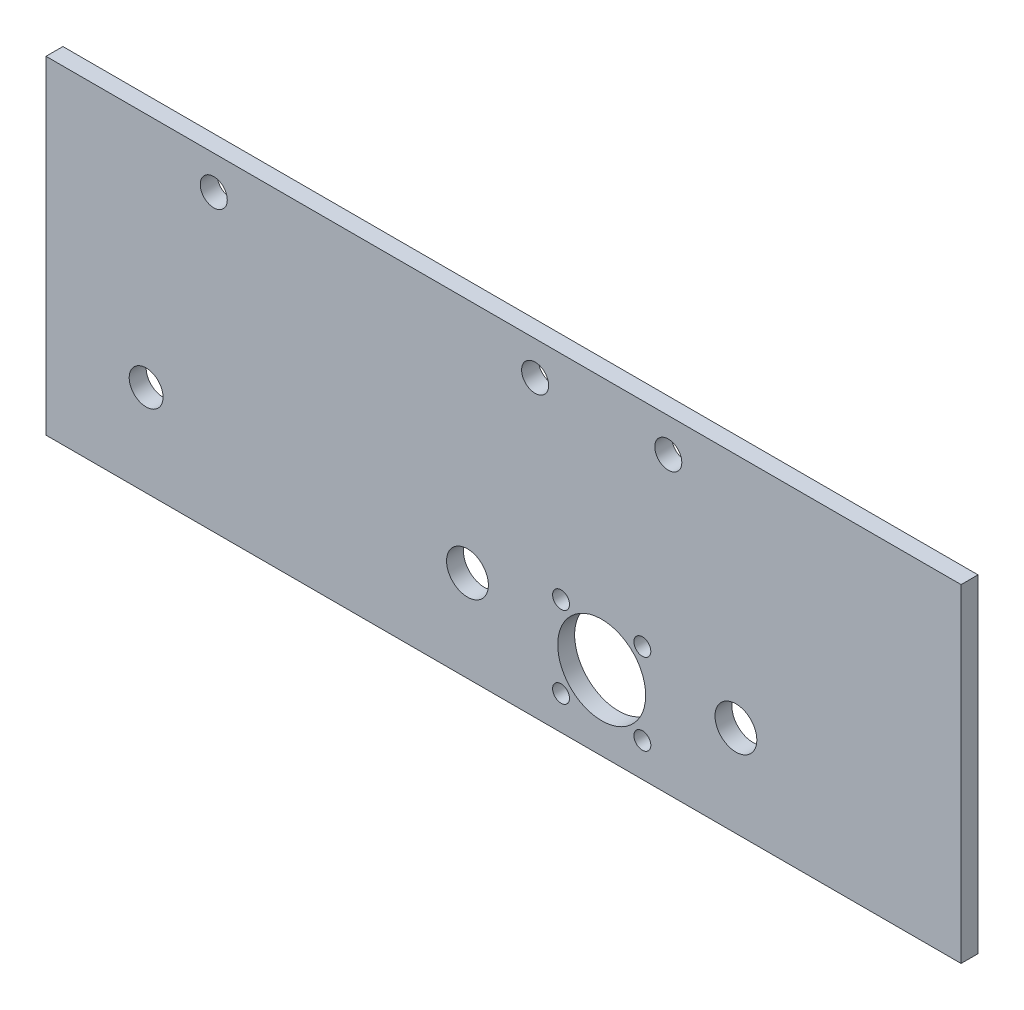
from build123d import *

# Parameters (mm, degrees)
SKETCH_1_W      = 270.571276656
SKETCH_1_H      = 97.02081528
SKETCH_1_R      = 13
SKETCH_1_R_2    = 2.5
SKETCH_1_R_3    = 6.183267946
SKETCH_1_R_4    = 5
SKETCH_1_R_5    = 4
EXTRUDE_1_DEPTH = 5


with BuildPart() as part:
    # Эскиз1 → Бобышка-Вытянуть1 (new body)
    with BuildSketch(Plane.XY):
        with Locations((-29.02181407, 26.48959236)):
            Rectangle(SKETCH_1_W, SKETCH_1_H)
        Circle(SKETCH_1_R, mode=Mode.SUBTRACT)
        with Locations((-12.02081528, 12.02081528)):
            Circle(SKETCH_1_R_2, mode=Mode.SUBTRACT)
        with Locations((12.02081528, 12.02081528)):
            Circle(SKETCH_1_R_2, mode=Mode.SUBTRACT)
        with Locations((12.02081528, -12.02081528)):
            Circle(SKETCH_1_R_2, mode=Mode.SUBTRACT)
        with Locations((-12.02081528, -12.02081528)):
            Circle(SKETCH_1_R_2, mode=Mode.SUBTRACT)
        with Locations((-39.686269666, 5)):
            Circle(SKETCH_1_R_3, mode=Mode.SUBTRACT)
        with Locations((39.686269666, 5)):
            Circle(SKETCH_1_R_3, mode=Mode.SUBTRACT)
        with Locations((-134.705238695, 5)):
            Circle(SKETCH_1_R_4, mode=Mode.SUBTRACT)
        with Locations((-19.686269666, 65)):
            Circle(SKETCH_1_R_5, mode=Mode.SUBTRACT)
        with Locations((19.686269666, 65)):
            Circle(SKETCH_1_R_5, mode=Mode.SUBTRACT)
        with Locations((-114.705238695, 65)):
            Circle(SKETCH_1_R_5, mode=Mode.SUBTRACT)
    extrude(amount=EXTRUDE_1_DEPTH)


solid = part.part
